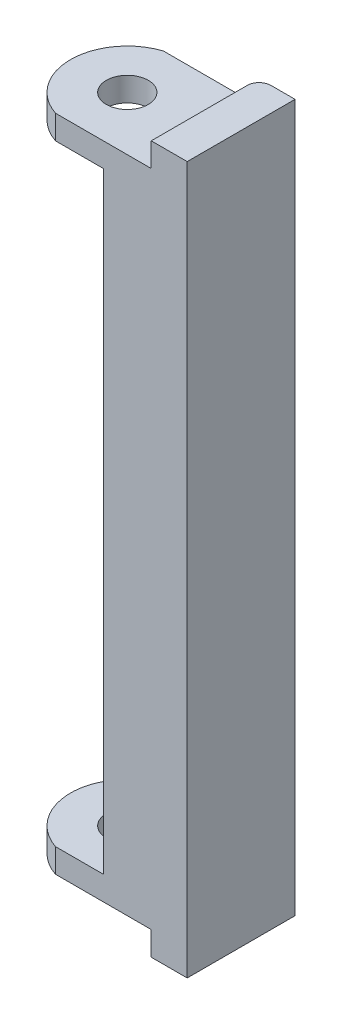
from build123d import *

# Parameters (mm, degrees)
SKETCH1_R           = 1.75
BOSS_EXTRUDE3_DEPTH = 2
BOSS_EXTRUDE4_DEPTH = 25.5
BOSS_EXTRUDE5_DEPTH = 4


with BuildPart() as part:
    # Sketch1 → Boss-Extrude3 (new body)
    with BuildSketch(Plane(origin=(0, 0, 0), x_dir=(1, 0, 0), z_dir=(0, 1, 0))):
        with BuildLine():
            ThreePointArc((-3.991008085, 4.5), (-7.240580672, 0), (-3.991008085, -4.5))
            Line((-3.991008085, -4.5), (7, -4.5))
            Line((7, -4.5), (7, 4.5))
            Line((7, 4.5), (-3.991008085, 4.5))
        make_face()
        with Locations((-2.5, 0)):
            Circle(SKETCH1_R, mode=Mode.SUBTRACT)
    extrude(amount=BOSS_EXTRUDE3_DEPTH)

    # Sketch1<3> → Boss-Extrude4 (add)
    with BuildSketch(Plane(origin=(0, 0, 0), x_dir=(1, 0, 0), z_dir=(0, 1, 0))):
        with BuildLine():
            ThreePointArc((0.004495957, 4.5), (2.65, 0), (0.004495957, -4.5))
            Line((0.004495957, -4.5), (7, -4.5))
            Line((7, -4.5), (7, 4.5))
            Line((7, 4.5), (0.004495957, 4.5))
        make_face()
    extrude(amount=-BOSS_EXTRUDE4_DEPTH)

    # Sketch1<5> → Boss-Extrude5 (add)
    with BuildSketch(Plane(origin=(0, 0, 0), x_dir=(1, 0, 0), z_dir=(0, 1, 0))):
        with BuildLine():
            Line((7, 4.5), (5, 4.5))
            ThreePointArc((5, 4.5), (4.292893219, 4.207106781), (4, 3.5))
            Line((4, 3.5), (4, -4.5))
            Line((4, -4.5), (7, -4.5))
            Line((7, -4.5), (7, 4.5))
        make_face()
    extrude(amount=BOSS_EXTRUDE5_DEPTH)

    # Mirror1: part across plane


with BuildPart() as part_1:
    add(part.part)
    add(part.part.mirror(Plane.ZX.offset(-25.5)))


solid = part_1.part
